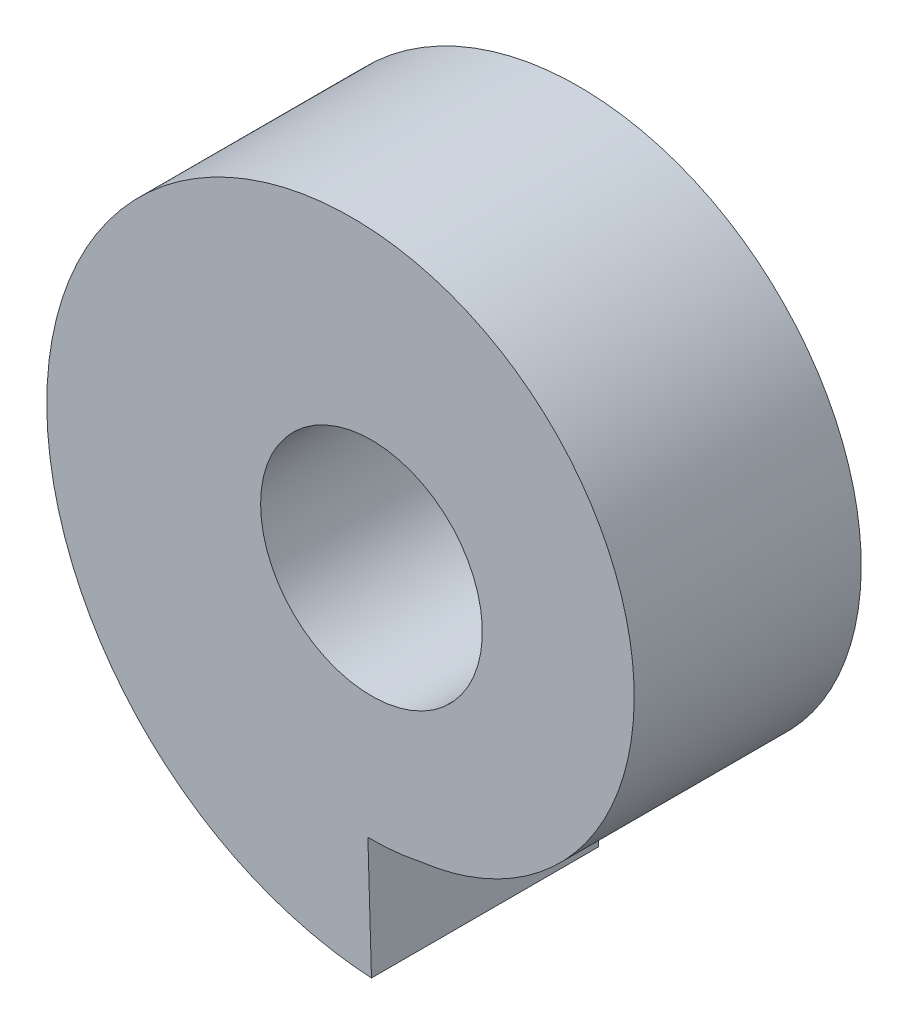
from build123d import *

# Parameters (mm, degrees)
BALAYAGE1_DEPTH  = 20.111990508
ESQUISSE14_R     = 20.828656766
ESQUISSE14_R_2   = 9.821536281
EXTRUSION1_DEPTH = 20.111990508


# Read off the part's stored shape, not the designer's step: Balayage1
with BuildPart() as part:
    # Balayage1 outline → Balayage1 (new body)
    with BuildSketch(Plane.XY):
        with BuildLine():
            Line((0, -9.821536281), (0, -20.458575472))
            add(Edge.make_bspline(
                [(0, -20.458575472), (1.339010626, -20.573158804), (2.70063028, -20.555850209), (5.416034469, -20.249379033), (6.769747496, -19.960201828), (9.414757989, -19.112650814), (10.705981442, -18.55427704), (13.172233247, -17.181996667), (14.347188089, -16.368105159), (16.530150458, -14.509233388), (17.538088045, -13.464283054), (19.341456378, -11.177840705), (20.136823748, -9.936392614), (21.476697608, -7.30049231), (22.021150084, -5.906096569), (22.829818439, -3.015315759), (23.093992141, -1.518997704), (23.323158802, 1.518997704), (23.288123466, 3.060599988), (22.911424817, 6.129061533), (22.569748615, 7.655840556), (21.584441456, 10.633423807), (20.940813937, 12.084145796), (19.368542637, 14.849705175), (18.439918891, 16.164461653), (16.326506952, 18.601964191), (15.141754982, 19.724634015), (12.55600506, 21.727993276), (11.155058431, 22.608614389), (8.186585371, 24.086244396), (6.619123633, 24.683195867), (3.375285466, 25.562091698), (1.698984783, 25.843992141), (-1.698984783, 26.073158802), (-3.420569696, 26.020396724), (-6.842088596, 25.573470601), (-8.541933617, 25.179295403), (-11.852089624, 24.056232097), (-13.46231015, 23.327350834), (-16.527177103, 21.555088608), (-17.981735217, 20.511732623), (-20.673777923, 18.143780517), (-21.911179985, 16.81922691), (-24.114530173, 13.934169414), (-25.08040503, 12.373724249), (-26.695791184, 9.072678431), (-27.345241651, 7.332150696), (-28.294364956, 3.735255174), (-28.593992141, 1.878971862), (-28.823158802, -1.878971862), (-28.752669983, -3.780539403), (-28.235516385, -7.55511566), (-27.78884219, -9.428026677), (-26.528022739, -13.070755442), (-25.713887731, -14.840474504), (-23.741634578, -18.204649031), (-22.583546355, -19.79900878), (-19.961054081, -22.745591656), (-18.496698837, -24.097725955), (-15.312333768, -26.501067071), (-13.592390066, -27.552195671), (-9.958771492, -29.305337972), (-8.04517776, -30.007287435), (-4.095224882, -31.026638215), (-2.058958944, -31.343992138), (0, -31.458575472)],
                knots=[0, 0, 0, 0, 0.03125, 0.03125, 0.0625, 0.0625, 0.09375, 0.09375, 0.125, 0.125, 0.15625, 0.15625, 0.1875, 0.1875, 0.21875, 0.21875, 0.25, 0.25, 0.28125, 0.28125, 0.3125, 0.3125, 0.34375, 0.34375, 0.375, 0.375, 0.40625, 0.40625, 0.4375, 0.4375, 0.46875, 0.46875, 0.5, 0.5, 0.53125, 0.53125, 0.5625, 0.5625, 0.59375, 0.59375, 0.625, 0.625, 0.65625, 0.65625, 0.6875, 0.6875, 0.71875, 0.71875, 0.75, 0.75, 0.78125, 0.78125, 0.8125, 0.8125, 0.84375, 0.84375, 0.875, 0.875, 0.90625, 0.90625, 0.9375, 0.9375, 0.96875, 0.96875, 1, 1, 1, 1], degree=3))
            Line((0, -31.458575472), (-0.316632886, -20.826249933))
            add(Edge.make_bspline(
                [(0, -9.821536281), (0.635526395, -9.936138625), (1.300455961, -9.987934945), (2.636552256, -9.957838834), (3.320925459, -9.873243661), (4.668076386, -9.5674891), (5.343310383, -9.341099222), (6.64362309, -8.754770806), (7.279880465, -8.38726265), (8.474113795, -7.527760952), (9.041558169, -7.02615667), (10.07176339, -5.913499999), (10.541916964, -5.291172391), (11.354136158, -3.957730474), (11.701234565, -3.234117001), (12.248134534, -1.72376755), (12.450416733, -0.923795696), (12.693735378, 0.709479025), (12.734607395, 1.556239501), (12.647294177, 3.250272888), (12.516309238, 4.110702398), (12.084251503, 5.797512451), (11.777855658, 6.636238321), (11.001097913, 8.244754836), (10.523099181, 9.025601486), (9.416482329, 10.484642069), (8.77821251, 11.172175284), (7.37138377, 12.413546157), (6.59153484, 12.97464608), (4.928305632, 13.936234248), (4.032436553, 14.34162839), (2.169493947, 14.970347994), (1.1892182, 15.196035253), (-0.805775701, 15.450493161), (-1.833897105, 15.478992523), (-3.884755387, 15.331746496), (-4.920576993, 15.153109804), (-6.945499252, 14.59240664), (-7.946859496, 14.204943326), (-9.86169286, 13.235843787), (-10.786126333, 12.646516501), (-12.507846215, 11.291337805), (-13.314370432, 10.515800987), (-14.764637575, 8.813835324), (-15.41553956, 7.876103443), (-16.524182446, 5.882601148), (-16.986728243, 4.81434898), (-17.694998732, 2.59878648), (-17.942990079, 1.438299746), (-18.206445521, -0.918016148), (-18.221552303, -2.127205893), (-18.012429229, -4.534115789), (-17.785233919, -5.744863598), (-17.094196375, -8.106806531), (-16.624897206, -9.270192625), (-15.462066247, -11.489998098), (-14.760798926, -12.557300792), (-13.155997853, -14.540171398), (-12.24275076, -15.464894963), (-10.244932242, -17.122416889), (-9.149046646, -17.862290367), (-6.824901676, -19.116303402), (-5.584165841, -19.635165362), (-3.015949138, -20.421325406), (-1.675315677, -20.690816726), (-0.316632886, -20.826249933)],
                knots=[0, 0, 0, 0, 0.03125, 0.03125, 0.0625, 0.0625, 0.09375, 0.09375, 0.125, 0.125, 0.15625, 0.15625, 0.1875, 0.1875, 0.21875, 0.21875, 0.25, 0.25, 0.28125, 0.28125, 0.3125, 0.3125, 0.34375, 0.34375, 0.375, 0.375, 0.40625, 0.40625, 0.4375, 0.4375, 0.46875, 0.46875, 0.5, 0.5, 0.53125, 0.53125, 0.5625, 0.5625, 0.59375, 0.59375, 0.625, 0.625, 0.65625, 0.65625, 0.6875, 0.6875, 0.71875, 0.71875, 0.75, 0.75, 0.78125, 0.78125, 0.8125, 0.8125, 0.84375, 0.84375, 0.875, 0.875, 0.90625, 0.90625, 0.9375, 0.9375, 0.96875, 0.96875, 1, 1, 1, 1], degree=3))
        make_face()
    extrude(amount=BALAYAGE1_DEPTH)

    # Esquisse14 → Extrusion1 (add)
    with BuildSketch(Plane(origin=(0, 0, 0), x_dir=(-1, 0, 0), z_dir=(0, 0, -1))):
        Circle(ESQUISSE14_R)
        Circle(ESQUISSE14_R_2, mode=Mode.SUBTRACT)
    extrude(amount=-EXTRUSION1_DEPTH)


solid = part.part
